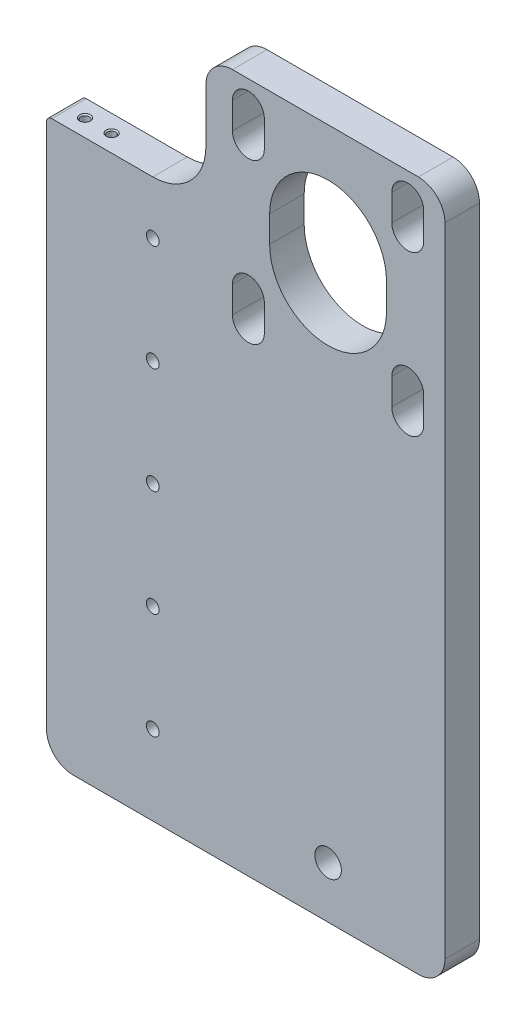
from build123d import *
from OCP.BRepFilletAPI import BRepFilletAPI_MakeFillet

# Parameters (mm, degrees)
SKETCH1_W                         = 75
SKETCH1_H                         = 130
MOUNTING_PLATE_DEPTH              = 6.5
MOTOR_MOUNT_DEPTH                 = 10
LPATTERN1_COUNT                   = 2
LPATTERN1_PITCH                   = 30
LPATTERN1_COUNT_DIR2              = 2
LPATTERN1_PITCH_DIR2              = 30
MOTOR_HOLE_DEPTH                  = 136.456635127
LIMIT_SWITCH_PLACEMENT_DEPTH      = 136.456635127
LIMIT_SWITCH_PLACEMENT_DEPTH_BACK = 136.456635127
SKETCH8_R                         = 1.2
SLIDE_HOLES_DEPTH                 = 136.456635127
LPATTERN2_COUNT                   = 5
LPATTERN2_PITCH                   = 20
FILLET1_R1                        = 5
FILLET1_R2                        = 1
SKETCH16_R                        = 2.5
CUT_EXTRUDE1_DEPTH                = 136.456635127
M3X0_5_TAPPED_HOLE1_D             = 2.5
M3X0_5_TAPPED_HOLE1_DEPTH         = 7.5
M3X0_5_TAPPED_HOLE1_TIP           = 0.751075774
M2X0_4_TAPPED_HOLE2_D             = 1.6
M2X0_4_TAPPED_HOLE2_CSINK_D       = 2.05
M2X0_4_TAPPED_HOLE2_CSINK_ANGLE   = 90
LPATTERN3_COUNT                   = 2
LPATTERN3_PITCH                   = 5
SKETCH19_R                        = 3
CUT_EXTRUDE2_DEPTH                = 3


with BuildPart() as part:
    # Sketch1 → Mounting Plate (new body)
    with BuildSketch(Plane.XY):
        with Locations((0, 65)):
            Rectangle(SKETCH1_W, SKETCH1_H)
    extrude(amount=MOUNTING_PLATE_DEPTH)

    # Sketch3 → Motor Mount (cut)
    with BuildSketch(Plane.XY.offset(6.5)):
        with BuildLine():
            Line((-2.5, 120), (-2.5, 125))
            ThreePointArc((-2.5, 125), (0.5, 128), (3.5, 125))
            Line((3.5, 125), (3.5, 120))
            ThreePointArc((3.5, 120), (0.5, 117), (-2.5, 120))
        make_face()
    motor_mount = extrude(amount=-MOTOR_MOUNT_DEPTH, mode=Mode.SUBTRACT)

    # LPattern1: Motor Mount 2 × 2
    with Locations(*[(i * LPATTERN1_PITCH, -j * LPATTERN1_PITCH_DIR2, 0) for i in range(LPATTERN1_COUNT) for j in range(LPATTERN1_COUNT_DIR2) if (i, j) != (0, 0)]):
        add(motor_mount, mode=Mode.SUBTRACT)

    # Sketch7 → Motor Hole (cut, through all)
    with BuildSketch(Plane.XY.offset(6.5)):
        with BuildLine():
            Line((4.5, 105), (4.5, 110))
            ThreePointArc((4.5, 110), (15.5, 121), (26.5, 110))
            Line((26.5, 110), (26.5, 105))
            ThreePointArc((26.5, 105), (15.5, 94), (4.5, 105))
        make_face()
    extrude(amount=-MOTOR_HOLE_DEPTH, mode=Mode.SUBTRACT)

    # Sketch2 → Limit Switch Placement (cut, two sides: drawn at the far end of the back side and taken through both)
    with BuildSketch(Plane.XY.offset(6.5).offset(-LIMIT_SWITCH_PLACEMENT_DEPTH_BACK)):
        with BuildLine():
            Line((-7.5, 415.136329844), (-7.5, 130))
            Line((-7.5, 130), (-7.5, 115))
            ThreePointArc((-7.5, 115), (-10.428932188, 107.928932188), (-17.5, 105))
            Line((-17.5, 105), (-37.5, 105))
            Line((-37.5, 105), (-322.636329844, 105))
            Line((-322.636329844, 105), (-722.642663203, 511.455212366))
            Line((-722.642663203, 511.455212366), (-407.50633336, 821.59154221))
            Line((-407.50633336, 821.59154221), (-7.5, 415.136329844))
        make_face()
    extrude(amount=LIMIT_SWITCH_PLACEMENT_DEPTH + LIMIT_SWITCH_PLACEMENT_DEPTH_BACK, mode=Mode.SUBTRACT)

    # Sketch8 → Slide Holes (cut, through all)
    with BuildSketch(Plane.XY.offset(6.5)):
        with Locations((-17.5, 95)):
            Circle(SKETCH8_R)
    slide_holes = extrude(amount=-SLIDE_HOLES_DEPTH, mode=Mode.SUBTRACT)

    # LPattern2: Slide Holes ×5
    with Locations(*[(0, -i * LPATTERN2_PITCH, 0) for i in range(1, LPATTERN2_COUNT)]):
        add(slide_holes, mode=Mode.SUBTRACT)

    # Fillet1: one fillet with a radius per group of edges: ONE call of the kernel's fillet builder (fillet() takes one radius for all edges)
    fillet1_edges_1 = [part.edges().sort_by_distance(p)[0] for p in [
        (37.5, 130, 3.25),
        (-7.5, 130, 3.25),
        (37.5, 0, 3.25),
        (-37.5, 0, 3.25),
    ]]
    fillet1_edges_2 = [part.edges().sort_by_distance(p)[0] for p in [
        (-37.5, 105, 3.25),
    ]]
    fillet1 = BRepFilletAPI_MakeFillet(part.part.solid().wrapped)
    for e in fillet1_edges_1:
        fillet1.Add(FILLET1_R1, e.wrapped)
    for e in fillet1_edges_2:
        fillet1.Add(FILLET1_R2, e.wrapped)
    add(Compound.cast(fillet1.Shape()), mode=Mode.REPLACE)

    # Sketch16 → Cut-Extrude1 (cut, through all)
    with BuildSketch(Plane.XY.offset(6.5)):
        with Locations((15.5, 9.71)):
            Circle(SKETCH16_R)
    extrude(amount=-CUT_EXTRUDE1_DEPTH, mode=Mode.SUBTRACT)

    # M3x0.5 Tapped Hole1
    with Locations(Plane(origin=(0, 0, 0), x_dir=(-1, 0, 0), z_dir=(0, -1, 0))):
        with Locations((-18.5, -3.25), (-12.5, -3.25)):
            Hole(M3X0_5_TAPPED_HOLE1_D / 2, depth=M3X0_5_TAPPED_HOLE1_DEPTH)
            with Locations((0, 0, -(M3X0_5_TAPPED_HOLE1_DEPTH + M3X0_5_TAPPED_HOLE1_TIP / 2))):  # 118° drill point
                Cone(0, M3X0_5_TAPPED_HOLE1_D / 2, M3X0_5_TAPPED_HOLE1_TIP, mode=Mode.SUBTRACT)

    # M2x0.4 Tapped Hole2 (through all)
    with Locations(Plane(origin=(0, 105, 0), x_dir=(1, 0, 0), z_dir=(0, 1, 0))):
        with Locations((-33.5, -3.25)):
            m2x0_4_tapped_hole2 = CounterSinkHole(M2X0_4_TAPPED_HOLE2_D / 2, M2X0_4_TAPPED_HOLE2_CSINK_D / 2, counter_sink_angle=M2X0_4_TAPPED_HOLE2_CSINK_ANGLE)

    # LPattern3: M2x0.4 Tapped Hole2 ×2
    with Locations(*[(i * LPATTERN3_PITCH, 0, 0) for i in range(1, LPATTERN3_COUNT)]):
        add(m2x0_4_tapped_hole2, mode=Mode.SUBTRACT)

    # Sketch19 → Cut-Extrude2 (cut)
    with BuildSketch(Plane(origin=(0, 0, 0), x_dir=(-1, 0, 0), z_dir=(0, 0, -1))):
        with Locations((-23.5, 40)):
            Circle(SKETCH19_R)
        with Locations((-23.5, 15)):
            Circle(SKETCH19_R)
        with Locations((1.5, 40)):
            Circle(SKETCH19_R)
        with Locations((1.5, 15)):
            Circle(SKETCH19_R)
    extrude(amount=-CUT_EXTRUDE2_DEPTH, mode=Mode.SUBTRACT)


solid = part.part
